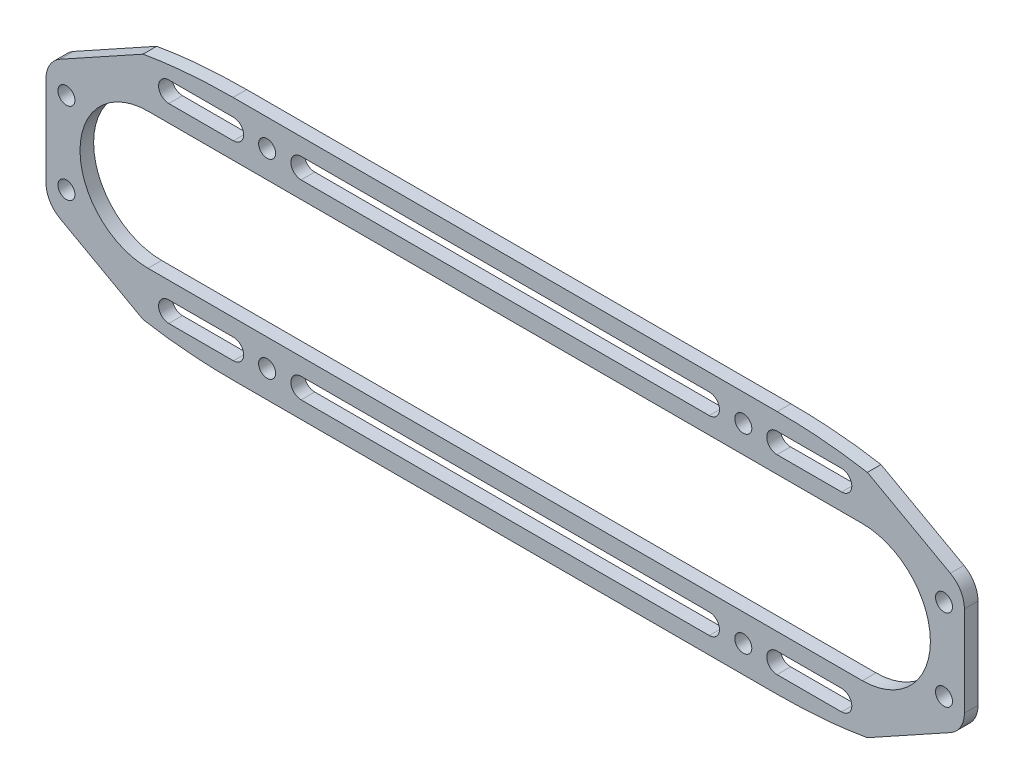
from build123d import *

# Parameters (mm, degrees)
SKETCH_1_W               = 135
SKETCH_1_H               = 18
EXTRUDE_1_DEPTH          = 2
EXTRUDE_2_DEPTH          = 2
CUT_EXTRUDE_1_DEPTH      = 70.887409578
CUT_EXTRUDE_1_DEPTH_BACK = 70.887409578
HOLE_WIZARD_1_D          = 2.5
CUT_EXTRUDE_2_DEPTH      = 70.887409578
CUT_EXTRUDE_2_DEPTH_BACK = 70.887409578
CUT_EXTRUDE_3_DEPTH      = 70.887409578
CUT_EXTRUDE_3_DEPTH_BACK = 70.887409578
CUT_EXTRUDE_4_DEPTH      = 70.887409578
CUT_EXTRUDE_4_DEPTH_BACK = 70.887409578


with BuildPart() as part:
    # 草图1 → 凸台-拉伸1 (new body)
    with BuildSketch(Plane.XY):
        Rectangle(SKETCH_1_W, SKETCH_1_H)
    extrude(amount=EXTRUDE_1_DEPTH)

    # 草图2 → 凸台-拉伸2 (add)
    with BuildSketch(Plane.XY.offset(2)):
        with BuildLine():
            Line((-40, 18), (40, 18))
            add(Edge.make_bspline(
                [(67.5, 9), (67.5, 18), (40, 18)],
                knots=[3.141592654, 3.141592654, 3.141592654, 4.71238898, 4.71238898, 4.71238898], degree=2, weights=[1, 0.707106781, 1]))
            Line((67.5, 9), (67.5, -9))
            add(Edge.make_bspline(
                [(40, -18), (67.5, -18), (67.5, -9)],
                knots=[1.570796327, 1.570796327, 1.570796327, 3.141592654, 3.141592654, 3.141592654], degree=2, weights=[1, 0.707106781, 1]))
            Line((40, -18), (-40, -18))
            add(Edge.make_bspline(
                [(-67.5, -9), (-67.5, -18), (-40, -18)],
                knots=[0, 0, 0, 1.570796327, 1.570796327, 1.570796327], degree=2, weights=[1, 0.707106781, 1]))
            Line((-67.5, -9), (-67.5, 9))
            add(Edge.make_bspline(
                [(-40, 18), (-67.5, 18), (-67.5, 9)],
                knots=[4.71238898, 4.71238898, 4.71238898, 6.283185307, 6.283185307, 6.283185307], degree=2, weights=[1, 0.707106781, 1]))
        make_face()
    extrude(amount=-EXTRUDE_2_DEPTH)

    # 草图3 → 切除-拉伸1 (cut, two sides: drawn at the far end of the back side and taken through both)
    with BuildSketch(Plane.XY.offset(2).offset(-CUT_EXTRUDE_1_DEPTH_BACK)):
        with BuildLine():
            Line((-52.5, 10), (52.5, 10))
            ThreePointArc((52.5, 10), (62.5, 0), (52.5, -10))
            Line((52.5, -10), (-52.5, -10))
            ThreePointArc((-52.5, -10), (-62.5, 0), (-52.5, 10))
        make_face()
    extrude(amount=CUT_EXTRUDE_1_DEPTH + CUT_EXTRUDE_1_DEPTH_BACK, mode=Mode.SUBTRACT)

    # 孔1 (through all)
    with Locations(Plane.XY.offset(2)):
        with Locations((-64.5, 6), (-64.5, -6), (-35, 14), (-35, -14), (35, -14), (35, 14), (64.5, 6), (64.5, -6)):
            Hole(HOLE_WIZARD_1_D / 2)

    # 草图8 → 切除-拉伸2 (cut, two sides: drawn at the far end of the back side and taken through both)
    with BuildSketch(Plane.XY.offset(2).offset(-CUT_EXTRUDE_2_DEPTH_BACK)):
        with BuildLine():
            Line((30, 12.5), (-30, 12.5))
            ThreePointArc((-30, 12.5), (-31.5, 14), (-30, 15.5))
            Line((-30, 15.5), (30, 15.5))
            ThreePointArc((30, 15.5), (31.5, 14), (30, 12.5))
        make_face()
        with BuildLine():
            Line((30, -12.5), (-30, -12.5))
            ThreePointArc((-30, -12.5), (-31.5, -14), (-30, -15.5))
            Line((-30, -15.5), (30, -15.5))
            ThreePointArc((30, -15.5), (31.5, -14), (30, -12.5))
        make_face()
    extrude(amount=CUT_EXTRUDE_2_DEPTH + CUT_EXTRUDE_2_DEPTH_BACK, mode=Mode.SUBTRACT)

    # 草图9 → 切除-拉伸3 (cut, two sides: drawn at the far end of the back side and taken through both)
    with BuildSketch(Plane.XY.offset(2).offset(-CUT_EXTRUDE_3_DEPTH_BACK)):
        with BuildLine():
            Line((49.45, 12.5), (39.95, 12.5))
            ThreePointArc((39.95, 12.5), (38.45, 14), (39.95, 15.5))
            Line((39.95, 15.5), (49.45, 15.5))
            ThreePointArc((49.45, 15.5), (50.95, 14), (49.45, 12.5))
        make_face()
        with BuildLine():
            Line((-49.45, 12.5), (-39.95, 12.5))
            ThreePointArc((-39.95, 12.5), (-38.45, 14), (-39.95, 15.5))
            Line((-39.95, 15.5), (-49.45, 15.5))
            ThreePointArc((-49.45, 15.5), (-50.95, 14), (-49.45, 12.5))
        make_face()
        with BuildLine():
            Line((49.45, -12.5), (39.95, -12.5))
            ThreePointArc((39.95, -12.5), (38.45, -14), (39.95, -15.5))
            Line((39.95, -15.5), (49.45, -15.5))
            ThreePointArc((49.45, -15.5), (50.95, -14), (49.45, -12.5))
        make_face()
        with BuildLine():
            Line((-49.45, -12.5), (-39.95, -12.5))
            ThreePointArc((-39.95, -12.5), (-38.45, -14), (-39.95, -15.5))
            Line((-39.95, -15.5), (-49.45, -15.5))
            ThreePointArc((-49.45, -15.5), (-50.95, -14), (-49.45, -12.5))
        make_face()
    extrude(amount=CUT_EXTRUDE_3_DEPTH + CUT_EXTRUDE_3_DEPTH_BACK, mode=Mode.SUBTRACT)

    # 草图11 → 切除-拉伸4 (cut, two sides: drawn at the far end of the back side and taken through both)
    with BuildSketch(Plane.XY.offset(2).offset(-CUT_EXTRUDE_4_DEPTH_BACK)):
        with BuildLine():
            Line((-65.436287573, 10.141660518), (-53.241324886, 16.888001352))
            Line((-53.241324886, 16.888001352), (-67.5, 16.888001352))
            Line((-67.5, 16.888001352), (-71.533153286, 6.638925257))
            Line((-71.533153286, 6.638925257), (-67.5, 5.591778345))
            Line((-67.5, 5.591778345), (-67.5, 6.641547601))
            ThreePointArc((-67.5, 6.641547601), (-66.945660335, 8.673154072), (-65.436287573, 10.141660518))
        make_face()
        with BuildLine():
            Line((71.533153286, 6.638925257), (67.5, 16.888001352))
            Line((67.5, 16.888001352), (53.241324886, 16.888001352))
            Line((53.241324886, 16.888001352), (65.436287573, 10.141660518))
            ThreePointArc((65.436287573, 10.141660518), (66.945660335, 8.673154072), (67.5, 6.641547601))
            Line((67.5, 6.641547601), (67.5, 5.591778345))
            Line((67.5, 5.591778345), (71.533153286, 6.638925257))
        make_face()
        with BuildLine():
            Line((65.436287573, -10.141660518), (53.241324886, -16.888001352))
            Line((53.241324886, -16.888001352), (67.5, -16.888001352))
            Line((67.5, -16.888001352), (71.533153286, -6.638925257))
            Line((71.533153286, -6.638925257), (67.5, -5.591778345))
            Line((67.5, -5.591778345), (67.5, -6.641547601))
            ThreePointArc((67.5, -6.641547601), (66.945660335, -8.673154072), (65.436287573, -10.141660518))
        make_face()
        with BuildLine():
            Line((-71.533153286, -6.638925257), (-67.5, -16.888001352))
            Line((-67.5, -16.888001352), (-53.241324886, -16.888001352))
            Line((-53.241324886, -16.888001352), (-65.436287573, -10.141660518))
            ThreePointArc((-65.436287573, -10.141660518), (-66.945660335, -8.673154072), (-67.5, -6.641547601))
            Line((-67.5, -6.641547601), (-67.5, -5.591778345))
            Line((-67.5, -5.591778345), (-71.533153286, -6.638925257))
        make_face()
    extrude(amount=CUT_EXTRUDE_4_DEPTH + CUT_EXTRUDE_4_DEPTH_BACK, mode=Mode.SUBTRACT)


solid = part.part
